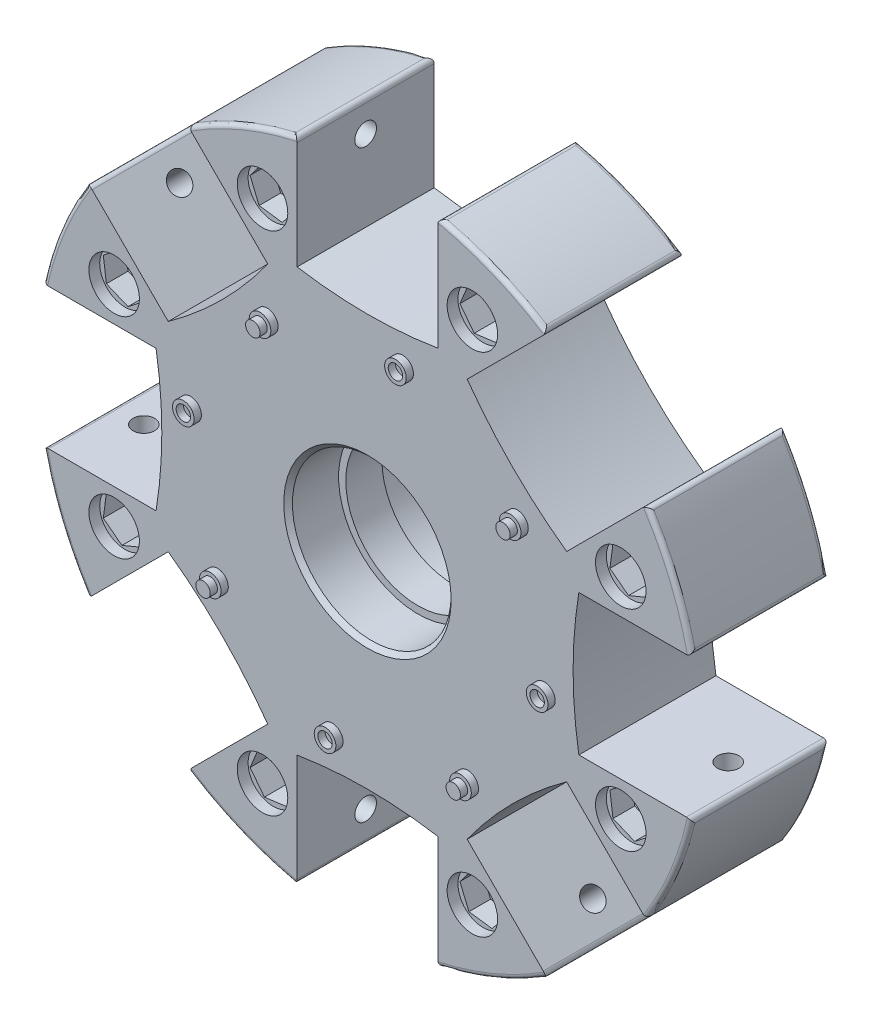
from build123d import *

# Parameters (mm, degrees)
SKETCH2_R                    = 1.75
SKETCH2_R_2                  = 10
BOSS_EXTRUDE1_DEPTH          = 9.5
FILLET2_R                    = 0.6
SKETCH3_R                    = 11
CUT_EXTRUDE1_DEPTH           = 7
CHAMFER1_SIZE                = 0.6
CUT_EXTRUDE2_START           = -1.5
CUT_EXTRUDE2_DEPTH           = 3
SKETCH7_R                    = 1.5
CUT_EXTRUDE4_DEPTH           = 15
CIRPATTERN2_COUNT            = 8
SKETCH8_R                    = 3.5
CUT_EXTRUDE5_DEPTH           = 1.5
CIRPATTERN3_START            = -1.5
CIRPATTERN3_COPY_1_DEPTH     = 3
CIRPATTERN3_COPY_2_DEPTH     = 3
CIRPATTERN3_COPY_3_DEPTH     = 3
CIRPATTERN3_COPY_4_DEPTH     = 3
CIRPATTERN3_COPY_5_DEPTH     = 3
CIRPATTERN3_COPY_6_DEPTH     = 3
CIRPATTERN3_COPY_7_DEPTH     = 3
CIRPATTERN3_COPY_8_SKETCH_R  = 3.5
CIRPATTERN3_COPY_8_DEPTH     = 1.5
CIRPATTERN3_COPY_9_SKETCH_R  = 3.5
CIRPATTERN3_COPY_9_DEPTH     = 1.5
CIRPATTERN3_COPY_10_SKETCH_R = 3.5
CIRPATTERN3_COPY_10_DEPTH    = 1.5
CIRPATTERN3_COPY_11_SKETCH_R = 3.5
CIRPATTERN3_COPY_11_DEPTH    = 1.5
CIRPATTERN3_COPY_12_SKETCH_R = 3.5
CIRPATTERN3_COPY_12_DEPTH    = 1.5
CIRPATTERN3_COPY_13_SKETCH_R = 3.5
CIRPATTERN3_COPY_13_DEPTH    = 1.5
CIRPATTERN3_COPY_14_SKETCH_R = 3.5
CIRPATTERN3_COPY_14_DEPTH    = 1.5
CIRPATTERN3_COPY_15_DEPTH    = 3
CIRPATTERN3_COPY_16_DEPTH    = 3
CIRPATTERN3_COPY_17_DEPTH    = 3
CIRPATTERN3_COPY_18_DEPTH    = 3
CIRPATTERN3_COPY_19_DEPTH    = 3
CIRPATTERN3_COPY_20_DEPTH    = 3
CIRPATTERN3_COPY_21_DEPTH    = 3
CIRPATTERN3_COPY_22_SKETCH_R = 3.5
CIRPATTERN3_COPY_22_DEPTH    = 1.5
CIRPATTERN3_COPY_23_SKETCH_R = 3.5
CIRPATTERN3_COPY_23_DEPTH    = 1.5
CIRPATTERN3_COPY_24_SKETCH_R = 3.5
CIRPATTERN3_COPY_24_DEPTH    = 1.5
CIRPATTERN3_COPY_25_SKETCH_R = 3.5
CIRPATTERN3_COPY_25_DEPTH    = 1.5
CIRPATTERN3_COPY_26_SKETCH_R = 3.5
CIRPATTERN3_COPY_26_DEPTH    = 1.5
CIRPATTERN3_COPY_27_SKETCH_R = 3.5
CIRPATTERN3_COPY_27_DEPTH    = 1.5
CIRPATTERN3_COPY_28_SKETCH_R = 3.5
CIRPATTERN3_COPY_28_DEPTH    = 1.5
SKETCH9_R                    = 1.5
BOSS_EXTRUDE2_DEPTH          = 1
SKETCH11_R                   = 1
BOSS_EXTRUDE4_DEPTH          = 1
SKETCH12_R                   = 1
CUT_EXTRUDE8_DEPTH           = 1
CIRPATTERN9_COUNT            = 4
MIRROR6_COPY_1_SKETCH_R      = 1
MIRROR6_COPY_1_DEPTH         = 1
MIRROR6_COPY_2_SKETCH_R      = 1
MIRROR6_COPY_2_DEPTH         = 1
MIRROR6_COPY_3_SKETCH_R      = 1
MIRROR6_COPY_3_DEPTH         = 1
MIRROR6_COPY_4_SKETCH_R      = 1
MIRROR6_COPY_4_DEPTH         = 1
MIRROR6_COPY_5_SKETCH_R      = 1
MIRROR6_COPY_5_DEPTH         = 1
MIRROR6_COPY_6_SKETCH_R      = 1
MIRROR6_COPY_6_DEPTH         = 1
MIRROR6_COPY_7_SKETCH_R      = 1
MIRROR6_COPY_7_DEPTH         = 1
MIRROR6_COPY_8_SKETCH_R      = 1
MIRROR6_COPY_8_DEPTH         = 1


with BuildPart() as part:
    # Sketch2 → Boss-Extrude1 (new, symmetric)
    with BuildSketch(Plane.XY):
        with BuildLine():
            Line((-9.75, 29.297487384), (-9.75, 44.954838449))
            ThreePointArc((-9.75, 44.954838449), (-17.603437889, 42.498458496), (-24.893579998, 38.682162231))
            Line((-24.893579998, 38.682162231), (-13.822160885, 27.610743118))
            ThreePointArc((-13.822160885, 27.610743118), (-20.152543264, 20.152543264), (-27.610743118, 13.822160885))
            Line((-27.610743118, 13.822160885), (-38.682162231, 24.893579998))
            ThreePointArc((-38.682162231, 24.893579998), (-42.498458496, 17.603437889), (-44.954838449, 9.75))
            Line((-44.954838449, 9.75), (-29.297487384, 9.75))
            ThreePointArc((-29.297487384, 9.75), (-28.5, 0), (-29.297487384, -9.75))
            Line((-29.297487384, -9.75), (-44.954838449, -9.75))
            ThreePointArc((-44.954838449, -9.75), (-42.498458496, -17.603437889), (-38.682162231, -24.893579998))
            Line((-38.682162231, -24.893579998), (-27.610743118, -13.822160885))
            ThreePointArc((-27.610743118, -13.822160885), (-20.152543264, -20.152543264), (-13.822160885, -27.610743118))
            Line((-13.822160885, -27.610743118), (-24.893579998, -38.682162231))
            ThreePointArc((-24.893579998, -38.682162231), (-17.603437889, -42.498458496), (-9.75, -44.954838449))
            Line((-9.75, -44.954838449), (-9.75, -29.297487384))
            ThreePointArc((-9.75, -29.297487384), (0, -28.5), (9.75, -29.297487384))
            Line((9.75, -29.297487384), (9.75, -44.954838449))
            ThreePointArc((9.75, -44.954838449), (17.603437889, -42.498458496), (24.893579998, -38.682162231))
            Line((24.893579998, -38.682162231), (13.822160885, -27.610743118))
            ThreePointArc((13.822160885, -27.610743118), (20.152543264, -20.152543264), (27.610743118, -13.822160885))
            Line((27.610743118, -13.822160885), (38.682162231, -24.893579998))
            ThreePointArc((38.682162231, -24.893579998), (42.498458496, -17.603437889), (44.954838449, -9.75))
            Line((44.954838449, -9.75), (29.297487384, -9.75))
            ThreePointArc((29.297487384, -9.75), (28.5, 0), (29.297487384, 9.75))
            Line((29.297487384, 9.75), (44.954838449, 9.75))
            ThreePointArc((44.954838449, 9.75), (42.498458496, 17.603437889), (38.682162231, 24.893579998))
            Line((38.682162231, 24.893579998), (27.610743118, 13.822160885))
            ThreePointArc((27.610743118, 13.822160885), (20.152543264, 20.152543264), (13.822160885, 27.610743118))
            Line((13.822160885, 27.610743118), (24.893579998, 38.682162231))
            ThreePointArc((24.893579998, 38.682162231), (17.603437889, 42.498458496), (9.75, 44.954838449))
            Line((9.75, 44.954838449), (9.75, 29.297487384))
            ThreePointArc((9.75, 29.297487384), (0, 28.5), (-9.75, 29.297487384))
        make_face()
        with Locations((-14.54197043, -35.107422235)):
            Circle(SKETCH2_R, mode=Mode.SUBTRACT)
        with Locations((-35.107422235, -14.54197043)):
            Circle(SKETCH2_R, mode=Mode.SUBTRACT)
        with Locations((14.54197043, -35.107422235)):
            Circle(SKETCH2_R, mode=Mode.SUBTRACT)
        with Locations((35.107422235, -14.54197043)):
            Circle(SKETCH2_R, mode=Mode.SUBTRACT)
        with Locations((-35.107422235, 14.54197043)):
            Circle(SKETCH2_R, mode=Mode.SUBTRACT)
        with Locations((-14.54197043, 35.107422235)):
            Circle(SKETCH2_R, mode=Mode.SUBTRACT)
        Circle(SKETCH2_R_2, mode=Mode.SUBTRACT)
        with Locations((35.107422235, 14.54197043)):
            Circle(SKETCH2_R, mode=Mode.SUBTRACT)
        with Locations((14.54197043, 35.107422235)):
            Circle(SKETCH2_R, mode=Mode.SUBTRACT)
    extrude(amount=BOSS_EXTRUDE1_DEPTH, both=True)

    # Fillet2
    fillet2_edges = [part.edges().sort_by_distance(p)[0] for p in [
        (-24.893579998, -38.682162231, 0),
        (-17.603437889, -42.498458496, 9.5),
        (-9.75, -44.954838449, 0),
        (-17.603437889, -42.498458496, -9.5),
        (-44.954838449, -9.75, 0),
        (-42.498458496, -17.603437889, 9.5),
        (-38.682162231, -24.893579998, 0),
        (-42.498458496, -17.603437889, -9.5),
        (-38.682162231, 24.893579998, 0),
        (-42.498458496, 17.603437889, 9.5),
        (-44.954838449, 9.75, 0),
        (-42.498458496, 17.603437889, -9.5),
        (-9.75, 44.954838449, 0),
        (-17.603437889, 42.498458496, 9.5),
        (-24.893579998, 38.682162231, 0),
        (-17.603437889, 42.498458496, -9.5),
        (24.893579998, 38.682162231, 0),
        (17.603437889, 42.498458496, 9.5),
        (9.75, 44.954838449, 0),
        (17.603437889, 42.498458496, -9.5),
        (9.75, -44.954838449, 0),
        (17.603437889, -42.498458496, 9.5),
        (24.893579998, -38.682162231, 0),
        (17.603437889, -42.498458496, -9.5),
        (38.682162231, -24.893579998, 0),
        (42.498458496, -17.603437889, 9.5),
        (44.954838449, -9.75, 0),
        (42.498458496, -17.603437889, -9.5),
        (44.954838449, 9.75, 0),
        (42.498458496, 17.603437889, 9.5),
        (38.682162231, 24.893579998, 0),
        (42.498458496, 17.603437889, -9.5),
    ]]
    fillet(fillet2_edges, radius=FILLET2_R)

    # Sketch3 → Cut-Extrude1 (cut)
    with BuildSketch(Plane.XY.offset(9.5)):
        Circle(SKETCH3_R)
    cut_extrude1 = extrude(amount=-CUT_EXTRUDE1_DEPTH, mode=Mode.SUBTRACT)

    # Mirror1: Cut-Extrude1 across plane
    add(cut_extrude1.mirror(Plane.XY), mode=Mode.SUBTRACT)

    # Chamfer1
    chamfer1_edges = [part.edges().sort_by_distance(p)[0] for p in [
        (-11, 0, 9.5),
        (-11, 0, -9.5),
    ]]
    chamfer(chamfer1_edges, length=CHAMFER1_SIZE)

    # Sketch4 → Cut-Extrude2 (cut)
    with BuildSketch(Plane(origin=(0, 0, -9.5), x_dir=(-1, 0, 0), z_dir=(0, 0, -1)).offset(CUT_EXTRUDE2_START)):
        Polygon((-13.298249275, 32.104813755), (-11.31977463, 34.683212111), (-12.563495786, 37.685820591), (-15.785691585, 38.110030716), (-17.764166229, 35.53163236), (-16.520445074, 32.529023879), align=None)
    cut_extrude2 = extrude(amount=-CUT_EXTRUDE2_DEPTH, mode=Mode.SUBTRACT)

    # Sketch7 → Cut-Extrude4 (cut, symmetric)
    with BuildSketch(Plane(origin=(0, 0, 0), x_dir=(0, 0, -1), z_dir=(1, 0, 0))):
        with Locations((0, 40.5)):
            Circle(SKETCH7_R)
    cut_extrude4 = extrude(amount=CUT_EXTRUDE4_DEPTH, both=True, mode=Mode.SUBTRACT)

    # CirPattern2: Cut-Extrude4 ×8 about axis
    cirpattern2_axis = Axis((0, 0, 2.5), (0, 0, 1))
    for i in range(1, CIRPATTERN2_COUNT):
        add(cut_extrude4.rotate(cirpattern2_axis, i * 360 / CIRPATTERN2_COUNT), mode=Mode.SUBTRACT)

    # Sketch8 → Cut-Extrude5 (cut)
    with BuildSketch(Plane(origin=(0, 0, -9.5), x_dir=(-1, 0, 0), z_dir=(0, 0, -1))):
        with Locations((-14.54197043, 35.107422235)):
            Circle(SKETCH8_R)
    cut_extrude5 = extrude(amount=-CUT_EXTRUDE5_DEPTH, mode=Mode.SUBTRACT)

    # Mirror2: Cut-Extrude2, Cut-Extrude5 across plane
    add(cut_extrude2.mirror(Plane.XY), mode=Mode.SUBTRACT)
    add(cut_extrude5.mirror(Plane.XY), mode=Mode.SUBTRACT)

    # CirPattern3 copy 1 sketch → CirPattern3 copy 1 (cut)
    with BuildSketch(Plane(origin=(0, 0, 9.5), x_dir=(-0.7071067811865476, 0.7071067811865475, 0), z_dir=(0, 0, 1)).offset(CIRPATTERN3_START)):
        Polygon((-13.298249275, -32.104813755), (-11.31977463, -34.683212111), (-12.563495786, -37.685820591), (-15.785691585, -38.110030716), (-17.764166229, -35.53163236), (-16.520445074, -32.529023879), align=None)
    extrude(amount=-CIRPATTERN3_COPY_1_DEPTH, mode=Mode.SUBTRACT)

    # CirPattern3 copy 2 sketch → CirPattern3 copy 2 (cut)
    with BuildSketch(Plane(origin=(0, 0, 9.5), x_dir=(0, 1, 0), z_dir=(0, 0, 1)).offset(CIRPATTERN3_START)):
        Polygon((-13.298249275, -32.104813755), (-11.31977463, -34.683212111), (-12.563495786, -37.685820591), (-15.785691585, -38.110030716), (-17.764166229, -35.53163236), (-16.520445074, -32.529023879), align=None)
    extrude(amount=-CIRPATTERN3_COPY_2_DEPTH, mode=Mode.SUBTRACT)

    # CirPattern3 copy 3 sketch → CirPattern3 copy 3 (cut)
    with BuildSketch(Plane(origin=(0, 0, 9.5), x_dir=(0.7071067811865475, 0.7071067811865476, 0), z_dir=(0, 0, 1)).offset(CIRPATTERN3_START)):
        Polygon((-13.298249275, -32.104813755), (-11.31977463, -34.683212111), (-12.563495786, -37.685820591), (-15.785691585, -38.110030716), (-17.764166229, -35.53163236), (-16.520445074, -32.529023879), align=None)
    extrude(amount=-CIRPATTERN3_COPY_3_DEPTH, mode=Mode.SUBTRACT)

    # CirPattern3 copy 4 sketch → CirPattern3 copy 4 (cut)
    with BuildSketch(Plane.XY.offset(9.5).offset(CIRPATTERN3_START)):
        Polygon((-13.298249275, -32.104813755), (-11.31977463, -34.683212111), (-12.563495786, -37.685820591), (-15.785691585, -38.110030716), (-17.764166229, -35.53163236), (-16.520445074, -32.529023879), align=None)
    extrude(amount=-CIRPATTERN3_COPY_4_DEPTH, mode=Mode.SUBTRACT)

    # CirPattern3 copy 5 sketch → CirPattern3 copy 5 (cut)
    with BuildSketch(Plane(origin=(0, 0, 9.5), x_dir=(0.7071067811865477, -0.7071067811865475, 0), z_dir=(0, 0, 1)).offset(CIRPATTERN3_START)):
        Polygon((-13.298249275, -32.104813755), (-11.31977463, -34.683212111), (-12.563495786, -37.685820591), (-15.785691585, -38.110030716), (-17.764166229, -35.53163236), (-16.520445074, -32.529023879), align=None)
    extrude(amount=-CIRPATTERN3_COPY_5_DEPTH, mode=Mode.SUBTRACT)

    # CirPattern3 copy 6 sketch → CirPattern3 copy 6 (cut)
    with BuildSketch(Plane(origin=(0, 0, 9.5), x_dir=(0, -1, 0), z_dir=(0, 0, 1)).offset(CIRPATTERN3_START)):
        Polygon((-13.298249275, -32.104813755), (-11.31977463, -34.683212111), (-12.563495786, -37.685820591), (-15.785691585, -38.110030716), (-17.764166229, -35.53163236), (-16.520445074, -32.529023879), align=None)
    extrude(amount=-CIRPATTERN3_COPY_6_DEPTH, mode=Mode.SUBTRACT)

    # CirPattern3 copy 7 sketch → CirPattern3 copy 7 (cut)
    with BuildSketch(Plane(origin=(0, 0, 9.5), x_dir=(-0.7071067811865474, -0.7071067811865477, 0), z_dir=(0, 0, 1)).offset(CIRPATTERN3_START)):
        Polygon((-13.298249275, -32.104813755), (-11.31977463, -34.683212111), (-12.563495786, -37.685820591), (-15.785691585, -38.110030716), (-17.764166229, -35.53163236), (-16.520445074, -32.529023879), align=None)
    extrude(amount=-CIRPATTERN3_COPY_7_DEPTH, mode=Mode.SUBTRACT)

    # CirPattern3 copy 8 sketch → CirPattern3 copy 8 (cut)
    with BuildSketch(Plane(origin=(0, 0, 9.5), x_dir=(-0.7071067811865476, 0.7071067811865475, 0), z_dir=(0, 0, 1))):
        with Locations((-14.54197043, -35.107422235)):
            Circle(CIRPATTERN3_COPY_8_SKETCH_R)
    extrude(amount=-CIRPATTERN3_COPY_8_DEPTH, mode=Mode.SUBTRACT)

    # CirPattern3 copy 9 sketch → CirPattern3 copy 9 (cut)
    with BuildSketch(Plane(origin=(0, 0, 9.5), x_dir=(0, 1, 0), z_dir=(0, 0, 1))):
        with Locations((-14.54197043, -35.107422235)):
            Circle(CIRPATTERN3_COPY_9_SKETCH_R)
    extrude(amount=-CIRPATTERN3_COPY_9_DEPTH, mode=Mode.SUBTRACT)

    # CirPattern3 copy 10 sketch → CirPattern3 copy 10 (cut)
    with BuildSketch(Plane(origin=(0, 0, 9.5), x_dir=(0.7071067811865475, 0.7071067811865476, 0), z_dir=(0, 0, 1))):
        with Locations((-14.54197043, -35.107422235)):
            Circle(CIRPATTERN3_COPY_10_SKETCH_R)
    extrude(amount=-CIRPATTERN3_COPY_10_DEPTH, mode=Mode.SUBTRACT)

    # CirPattern3 copy 11 sketch → CirPattern3 copy 11 (cut)
    with BuildSketch(Plane.XY.offset(9.5)):
        with Locations((-14.54197043, -35.107422235)):
            Circle(CIRPATTERN3_COPY_11_SKETCH_R)
    extrude(amount=-CIRPATTERN3_COPY_11_DEPTH, mode=Mode.SUBTRACT)

    # CirPattern3 copy 12 sketch → CirPattern3 copy 12 (cut)
    with BuildSketch(Plane(origin=(0, 0, 9.5), x_dir=(0.7071067811865477, -0.7071067811865475, 0), z_dir=(0, 0, 1))):
        with Locations((-14.54197043, -35.107422235)):
            Circle(CIRPATTERN3_COPY_12_SKETCH_R)
    extrude(amount=-CIRPATTERN3_COPY_12_DEPTH, mode=Mode.SUBTRACT)

    # CirPattern3 copy 13 sketch → CirPattern3 copy 13 (cut)
    with BuildSketch(Plane(origin=(0, 0, 9.5), x_dir=(0, -1, 0), z_dir=(0, 0, 1))):
        with Locations((-14.54197043, -35.107422235)):
            Circle(CIRPATTERN3_COPY_13_SKETCH_R)
    extrude(amount=-CIRPATTERN3_COPY_13_DEPTH, mode=Mode.SUBTRACT)

    # CirPattern3 copy 14 sketch → CirPattern3 copy 14 (cut)
    with BuildSketch(Plane(origin=(0, 0, 9.5), x_dir=(-0.7071067811865474, -0.7071067811865477, 0), z_dir=(0, 0, 1))):
        with Locations((-14.54197043, -35.107422235)):
            Circle(CIRPATTERN3_COPY_14_SKETCH_R)
    extrude(amount=-CIRPATTERN3_COPY_14_DEPTH, mode=Mode.SUBTRACT)

    # CirPattern3 copy 15 sketch → CirPattern3 copy 15 (cut)
    with BuildSketch(Plane(origin=(0, 0, -9.5), x_dir=(-0.7071067811865476, 0.7071067811865475, 0), z_dir=(0, 0, -1)).offset(CIRPATTERN3_START)):
        Polygon((-13.298249275, 32.104813755), (-11.31977463, 34.683212111), (-12.563495786, 37.685820591), (-15.785691585, 38.110030716), (-17.764166229, 35.53163236), (-16.520445074, 32.529023879), align=None)
    extrude(amount=-CIRPATTERN3_COPY_15_DEPTH, mode=Mode.SUBTRACT)

    # CirPattern3 copy 16 sketch → CirPattern3 copy 16 (cut)
    with BuildSketch(Plane.YX.offset(9.5).offset(CIRPATTERN3_START)):
        Polygon((-13.298249275, 32.104813755), (-11.31977463, 34.683212111), (-12.563495786, 37.685820591), (-15.785691585, 38.110030716), (-17.764166229, 35.53163236), (-16.520445074, 32.529023879), align=None)
    extrude(amount=-CIRPATTERN3_COPY_16_DEPTH, mode=Mode.SUBTRACT)

    # CirPattern3 copy 17 sketch → CirPattern3 copy 17 (cut)
    with BuildSketch(Plane(origin=(0, 0, -9.5), x_dir=(0.7071067811865475, 0.7071067811865476, 0), z_dir=(0, 0, -1)).offset(CIRPATTERN3_START)):
        Polygon((-13.298249275, 32.104813755), (-11.31977463, 34.683212111), (-12.563495786, 37.685820591), (-15.785691585, 38.110030716), (-17.764166229, 35.53163236), (-16.520445074, 32.529023879), align=None)
    extrude(amount=-CIRPATTERN3_COPY_17_DEPTH, mode=Mode.SUBTRACT)

    # CirPattern3 copy 18 sketch → CirPattern3 copy 18 (cut)
    with BuildSketch(Plane(origin=(0, 0, -9.5), x_dir=(1, 0, 0), z_dir=(0, 0, -1)).offset(CIRPATTERN3_START)):
        Polygon((-13.298249275, 32.104813755), (-11.31977463, 34.683212111), (-12.563495786, 37.685820591), (-15.785691585, 38.110030716), (-17.764166229, 35.53163236), (-16.520445074, 32.529023879), align=None)
    extrude(amount=-CIRPATTERN3_COPY_18_DEPTH, mode=Mode.SUBTRACT)

    # CirPattern3 copy 19 sketch → CirPattern3 copy 19 (cut)
    with BuildSketch(Plane(origin=(0, 0, -9.5), x_dir=(0.7071067811865477, -0.7071067811865475, 0), z_dir=(0, 0, -1)).offset(CIRPATTERN3_START)):
        Polygon((-13.298249275, 32.104813755), (-11.31977463, 34.683212111), (-12.563495786, 37.685820591), (-15.785691585, 38.110030716), (-17.764166229, 35.53163236), (-16.520445074, 32.529023879), align=None)
    extrude(amount=-CIRPATTERN3_COPY_19_DEPTH, mode=Mode.SUBTRACT)

    # CirPattern3 copy 20 sketch → CirPattern3 copy 20 (cut)
    with BuildSketch(Plane(origin=(0, 0, -9.5), x_dir=(0, -1, 0), z_dir=(0, 0, -1)).offset(CIRPATTERN3_START)):
        Polygon((-13.298249275, 32.104813755), (-11.31977463, 34.683212111), (-12.563495786, 37.685820591), (-15.785691585, 38.110030716), (-17.764166229, 35.53163236), (-16.520445074, 32.529023879), align=None)
    extrude(amount=-CIRPATTERN3_COPY_20_DEPTH, mode=Mode.SUBTRACT)

    # CirPattern3 copy 21 sketch → CirPattern3 copy 21 (cut)
    with BuildSketch(Plane(origin=(0, 0, -9.5), x_dir=(-0.7071067811865474, -0.7071067811865477, 0), z_dir=(0, 0, -1)).offset(CIRPATTERN3_START)):
        Polygon((-13.298249275, 32.104813755), (-11.31977463, 34.683212111), (-12.563495786, 37.685820591), (-15.785691585, 38.110030716), (-17.764166229, 35.53163236), (-16.520445074, 32.529023879), align=None)
    extrude(amount=-CIRPATTERN3_COPY_21_DEPTH, mode=Mode.SUBTRACT)

    # CirPattern3 copy 22 sketch → CirPattern3 copy 22 (cut)
    with BuildSketch(Plane(origin=(0, 0, -9.5), x_dir=(-0.7071067811865476, 0.7071067811865475, 0), z_dir=(0, 0, -1))):
        with Locations((-14.54197043, 35.107422235)):
            Circle(CIRPATTERN3_COPY_22_SKETCH_R)
    extrude(amount=-CIRPATTERN3_COPY_22_DEPTH, mode=Mode.SUBTRACT)

    # CirPattern3 copy 23 sketch → CirPattern3 copy 23 (cut)
    with BuildSketch(Plane.YX.offset(9.5)):
        with Locations((-14.54197043, 35.107422235)):
            Circle(CIRPATTERN3_COPY_23_SKETCH_R)
    extrude(amount=-CIRPATTERN3_COPY_23_DEPTH, mode=Mode.SUBTRACT)

    # CirPattern3 copy 24 sketch → CirPattern3 copy 24 (cut)
    with BuildSketch(Plane(origin=(0, 0, -9.5), x_dir=(0.7071067811865475, 0.7071067811865476, 0), z_dir=(0, 0, -1))):
        with Locations((-14.54197043, 35.107422235)):
            Circle(CIRPATTERN3_COPY_24_SKETCH_R)
    extrude(amount=-CIRPATTERN3_COPY_24_DEPTH, mode=Mode.SUBTRACT)

    # CirPattern3 copy 25 sketch → CirPattern3 copy 25 (cut)
    with BuildSketch(Plane(origin=(0, 0, -9.5), x_dir=(1, 0, 0), z_dir=(0, 0, -1))):
        with Locations((-14.54197043, 35.107422235)):
            Circle(CIRPATTERN3_COPY_25_SKETCH_R)
    extrude(amount=-CIRPATTERN3_COPY_25_DEPTH, mode=Mode.SUBTRACT)

    # CirPattern3 copy 26 sketch → CirPattern3 copy 26 (cut)
    with BuildSketch(Plane(origin=(0, 0, -9.5), x_dir=(0.7071067811865477, -0.7071067811865475, 0), z_dir=(0, 0, -1))):
        with Locations((-14.54197043, 35.107422235)):
            Circle(CIRPATTERN3_COPY_26_SKETCH_R)
    extrude(amount=-CIRPATTERN3_COPY_26_DEPTH, mode=Mode.SUBTRACT)

    # CirPattern3 copy 27 sketch → CirPattern3 copy 27 (cut)
    with BuildSketch(Plane(origin=(0, 0, -9.5), x_dir=(0, -1, 0), z_dir=(0, 0, -1))):
        with Locations((-14.54197043, 35.107422235)):
            Circle(CIRPATTERN3_COPY_27_SKETCH_R)
    extrude(amount=-CIRPATTERN3_COPY_27_DEPTH, mode=Mode.SUBTRACT)

    # CirPattern3 copy 28 sketch → CirPattern3 copy 28 (cut)
    with BuildSketch(Plane(origin=(0, 0, -9.5), x_dir=(-0.7071067811865474, -0.7071067811865477, 0), z_dir=(0, 0, -1))):
        with Locations((-14.54197043, 35.107422235)):
            Circle(CIRPATTERN3_COPY_28_SKETCH_R)
    extrude(amount=-CIRPATTERN3_COPY_28_DEPTH, mode=Mode.SUBTRACT)

    # Sketch9 → Boss-Extrude2 (add)
    with BuildSketch(Plane(origin=(0, 0, -9.5), x_dir=(-1, 0, 0), z_dir=(0, 0, -1))):
        with Locations((13.889255825, 20.786740308)):
            Circle(SKETCH9_R)
        with Locations((-4.87725805, 24.51963201)):
            Circle(SKETCH9_R)
        with Locations((24.51963201, 4.87725805)):
            Circle(SKETCH9_R)
        with Locations((20.786740308, -13.889255825)):
            Circle(SKETCH9_R)
        with Locations((4.87725805, -24.51963201)):
            Circle(SKETCH9_R)
        with Locations((-13.889255825, -20.786740308)):
            Circle(SKETCH9_R)
        with Locations((-24.51963201, -4.87725805)):
            Circle(SKETCH9_R)
        with Locations((-20.786740308, 13.889255825)):
            Circle(SKETCH9_R)
    boss_extrude2 = extrude(amount=BOSS_EXTRUDE2_DEPTH)

    # Mirror5: Boss-Extrude2 across plane
    add(boss_extrude2.mirror(Plane.XY))

    # Sketch11 → Boss-Extrude4 (add)
    with BuildSketch(Plane.XY.offset(10.5)):
        with Locations((20.786740308, 13.889255825)):
            Circle(SKETCH11_R)
    boss_extrude4 = extrude(amount=BOSS_EXTRUDE4_DEPTH)

    # Sketch12 → Cut-Extrude8 (cut)
    with BuildSketch(Plane.XY.offset(10.5)):
        with Locations((24.51963201, -4.87725805)):
            Circle(SKETCH12_R)
    cut_extrude8 = extrude(amount=-CUT_EXTRUDE8_DEPTH, mode=Mode.SUBTRACT)

    # CirPattern9: Boss-Extrude4, Cut-Extrude8 ×4 about axis
    cirpattern9_axis = Axis((0, 0, 2.5), (0, 0, 1))
    add([boss_extrude4.rotate(cirpattern9_axis, i * 360 / CIRPATTERN9_COUNT) for i in range(1, CIRPATTERN9_COUNT)])
    add([cut_extrude8.rotate(cirpattern9_axis, i * 360 / CIRPATTERN9_COUNT) for i in range(1, CIRPATTERN9_COUNT)], mode=Mode.SUBTRACT)

    # Mirror6 copy 1 sketch → Mirror6 copy 1 (add)
    with BuildSketch(Plane.YX.offset(10.5)):
        with Locations((20.786740308, -13.889255825)):
            Circle(MIRROR6_COPY_1_SKETCH_R)
    extrude(amount=MIRROR6_COPY_1_DEPTH)

    # Mirror6 copy 2 sketch → Mirror6 copy 2 (add)
    with BuildSketch(Plane(origin=(0, 0, -10.5), x_dir=(-1, 0, 0), z_dir=(0, 0, -1))):
        with Locations((20.786740308, -13.889255825)):
            Circle(MIRROR6_COPY_2_SKETCH_R)
    extrude(amount=MIRROR6_COPY_2_DEPTH)

    # Mirror6 copy 3 sketch → Mirror6 copy 3 (add)
    with BuildSketch(Plane(origin=(0, 0, -10.5), x_dir=(0, -1, 0), z_dir=(0, 0, -1))):
        with Locations((20.786740308, -13.889255825)):
            Circle(MIRROR6_COPY_3_SKETCH_R)
    extrude(amount=MIRROR6_COPY_3_DEPTH)

    # Mirror6 copy 4 sketch → Mirror6 copy 4 (cut)
    with BuildSketch(Plane.YX.offset(10.5)):
        with Locations((24.51963201, 4.87725805)):
            Circle(MIRROR6_COPY_4_SKETCH_R)
    extrude(amount=-MIRROR6_COPY_4_DEPTH, mode=Mode.SUBTRACT)

    # Mirror6 copy 5 sketch → Mirror6 copy 5 (cut)
    with BuildSketch(Plane(origin=(0, 0, -10.5), x_dir=(-1, 0, 0), z_dir=(0, 0, -1))):
        with Locations((24.51963201, 4.87725805)):
            Circle(MIRROR6_COPY_5_SKETCH_R)
    extrude(amount=-MIRROR6_COPY_5_DEPTH, mode=Mode.SUBTRACT)

    # Mirror6 copy 6 sketch → Mirror6 copy 6 (cut)
    with BuildSketch(Plane(origin=(0, 0, -10.5), x_dir=(0, -1, 0), z_dir=(0, 0, -1))):
        with Locations((24.51963201, 4.87725805)):
            Circle(MIRROR6_COPY_6_SKETCH_R)
    extrude(amount=-MIRROR6_COPY_6_DEPTH, mode=Mode.SUBTRACT)

    # Mirror6 copy 7 sketch → Mirror6 copy 7 (add)
    with BuildSketch(Plane(origin=(0, 0, -10.5), x_dir=(1, 0, 0), z_dir=(0, 0, -1))):
        with Locations((20.786740308, -13.889255825)):
            Circle(MIRROR6_COPY_7_SKETCH_R)
    extrude(amount=MIRROR6_COPY_7_DEPTH)

    # Mirror6 copy 8 sketch → Mirror6 copy 8 (cut)
    with BuildSketch(Plane(origin=(0, 0, -10.5), x_dir=(1, 0, 0), z_dir=(0, 0, -1))):
        with Locations((24.51963201, 4.87725805)):
            Circle(MIRROR6_COPY_8_SKETCH_R)
    extrude(amount=-MIRROR6_COPY_8_DEPTH, mode=Mode.SUBTRACT)


solid = part.part
